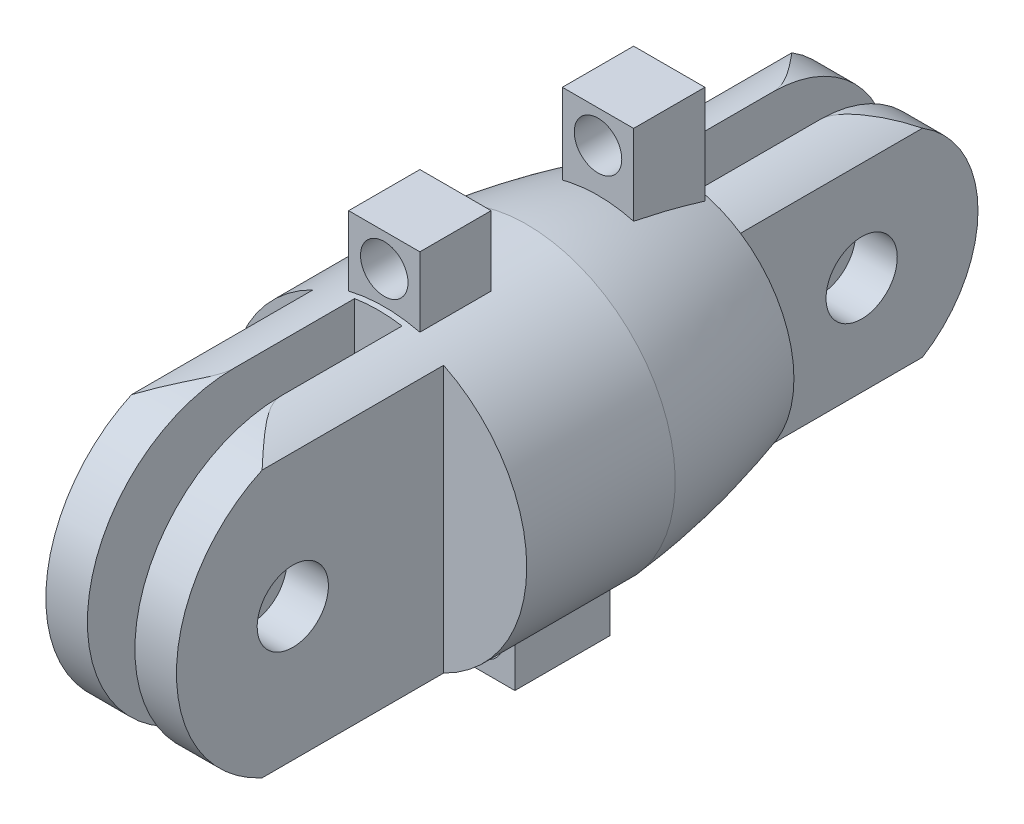
from build123d import *

# Parameters (mm, degrees)
SKETCH1_W                = 11
SKETCH1_H                = 25
BOSS_EXTRUDE1_DEPTH      = 35
CUT_EXTRUDE9_DEPTH       = 31.868357473
CUT_EXTRUDE9_DEPTH_BACK  = 31.868357473
SKETCH6_R                = 20
SKETCH6_R_2              = 12.5
SKETCH7_W                = 11
SKETCH7_H                = 20
BOSS_EXTRUDE3_DEPTH      = 20
SKETCH8_R                = 15
SKETCH8_R_2              = 10
CUT_EXTRUDE10_DEPTH      = 51.682837382
CUT_EXTRUDE11_DEPTH      = 40.210967919
CUT_EXTRUDE11_DEPTH_BACK = 40.210967919
SKETCH9_W                = 4
SKETCH9_H                = 20
SKETCH9_H_2              = 22.5
CUT_EXTRUDE15_START      = -3.5
CUT_EXTRUDE15_DEPTH      = 11
CUT_EXTRUDE16_DEPTH      = 40.893608668
CUT_EXTRUDE16_DEPTH_BACK = 40.893608668
CUT_EXTRUDE17_DEPTH      = 42.29467294
CUT_EXTRUDE17_DEPTH_BACK = 42.29467294
SKETCH14_R               = 3
SKETCH15_W               = 6
SKETCH15_H               = 8
BOSS_EXTRUDE5_DEPTH      = 18
SKETCH17_R               = 2
CUT_EXTRUDE19_DEPTH      = 45.735332948
SKETCH20_W               = 6
SKETCH20_H               = 6
BOSS_EXTRUDE7_DEPTH      = 18
SKETCH21_R               = 2
CUT_EXTRUDE22_DEPTH      = 50.603427453
SCALE1_SCALE             = 0.75


# Read off the part's stored shape, not the designer's step: Cut-Extrude15
with BuildPart() as part:
    # Sketch1 → Boss-Extrude1 (new body)
    with BuildSketch(Plane.XY):
        Rectangle(SKETCH1_W, SKETCH1_H)
    extrude(amount=BOSS_EXTRUDE1_DEPTH)


with BuildPart() as body_2:
    # Sketch2 → Revolve1 (revolve)
    with BuildSketch(Plane(origin=(0, 0, 0), x_dir=(0, 0, -1), z_dir=(1, 0, 0))):
        with BuildLine():
            Line((-12.5, 0), (12.5, 0))
            Line((12.5, 0), (12.5, 10))
            add(Edge.make_bspline(
                [(-12.5, 12.5), (0.245145169, 13.725725845), (12.5, 10)],
                knots=[0, 0, 0, 1, 1, 1], degree=2))
            Line((-12.5, 12.5), (-12.5, 0))
        make_face()
    revolve(axis=Axis((0, 0, 12.5), (0, 0, -1)))


with BuildPart() as cut_extrude9_tool:
    # Sketch6 → Cut-Extrude9 (new, two sides: drawn at the far end of the back side and taken through both)
    with BuildSketch(Plane.XY.offset(12.5).offset(-CUT_EXTRUDE9_DEPTH_BACK)):
        Circle(SKETCH6_R)
        with Locations(Location((0, 0, 0), (0, 0, 270))):
            Circle(SKETCH6_R_2, mode=Mode.SUBTRACT)
    extrude(amount=CUT_EXTRUDE9_DEPTH + CUT_EXTRUDE9_DEPTH_BACK)


with BuildPart() as part_1:
    add(part.part)

    # Cut-Extrude9: cut by cut_extrude9_tool
    add(cut_extrude9_tool.part, mode=Mode.SUBTRACT)


with BuildPart() as body_2_1:
    add(body_2.part)

    # Cut-Extrude9: cut by cut_extrude9_tool
    add(cut_extrude9_tool.part, mode=Mode.SUBTRACT)

    # Sketch7 → Boss-Extrude3 (add)
    with BuildSketch(Plane(origin=(0, 0, -12.5), x_dir=(-1, 0, 0), z_dir=(0, 0, -1))):
        Rectangle(SKETCH7_W, SKETCH7_H)
    extrude(amount=BOSS_EXTRUDE3_DEPTH)

    # Sketch8 → Cut-Extrude10 (cut, through all)
    with BuildSketch(Plane(origin=(0, 0, -12.5), x_dir=(-1, 0, 0), z_dir=(0, 0, -1))):
        Circle(SKETCH8_R)
        Circle(SKETCH8_R_2, mode=Mode.SUBTRACT)
    extrude(amount=CUT_EXTRUDE10_DEPTH, mode=Mode.SUBTRACT)


with BuildPart() as cut_extrude11_tool:
    # Sketch9 → Cut-Extrude11 (new, two sides: drawn at the far end of the back side and taken through both)
    with BuildSketch(Plane(origin=(0, 0, 0), x_dir=(1, 0, 0), z_dir=(0, 1, 0)).offset(-CUT_EXTRUDE11_DEPTH_BACK)):
        with Locations((0, 22.5)):
            Rectangle(SKETCH9_W, SKETCH9_H)
        with Locations((0, -23.75)):
            Rectangle(SKETCH9_W, SKETCH9_H_2)
    extrude(amount=CUT_EXTRUDE11_DEPTH + CUT_EXTRUDE11_DEPTH_BACK)


with BuildPart() as part_2:
    add(part_1.part)

    # Cut-Extrude11: cut by cut_extrude11_tool
    add(cut_extrude11_tool.part, mode=Mode.SUBTRACT)

    # Cut-Extrude15 outline → Cut-Extrude15 (cut)
    with BuildSketch(Plane(origin=(-2, 0, 0), x_dir=(0, 0, -1), z_dir=(1, 0, 0)).offset(CUT_EXTRUDE15_START)):
        with BuildLine():
            Line((-35, 12.338962679), (-35, -1.7e-08))
            ThreePointArc((-35, -1.7e-08), (-31.38600151, 8.724964177), (-22.661037321, 12.338962679))
            Line((-22.661037321, 12.338962679), (-35, 12.338962679))
        make_face()
        with BuildLine():
            Line((-35, -12.338962679), (-22.661037321, -12.338962679))
            ThreePointArc((-22.661037321, -12.338962679), (-31.386001498, -8.724964189), (-35, -1.7e-08))
            Line((-35, -1.7e-08), (-35, -12.338962679))
        make_face()
    extrude(amount=CUT_EXTRUDE15_DEPTH, mode=Mode.SUBTRACT)


with BuildPart() as body_2_2:
    add(body_2_1.part)

    # Cut-Extrude11: cut by cut_extrude11_tool
    add(cut_extrude11_tool.part, mode=Mode.SUBTRACT)

    # Sketch12 → Cut-Extrude16 (cut, two sides: drawn at the far end of the back side and taken through both)
    with BuildSketch(Plane.ZY.offset(-2).offset(-CUT_EXTRUDE16_DEPTH_BACK)):
        with BuildLine():
            ThreePointArc((-32.5, 0), (-29.630244259, 6.92820323), (-22.702041029, 9.797958971))
            Line((-22.702041029, 9.797958971), (-32.5, 9.797958971))
            Line((-32.5, 9.797958971), (-32.5, 0))
        make_face()
        with BuildLine():
            ThreePointArc((-22.702041029, -9.797958971), (-29.630244259, -6.92820323), (-32.5, 0))
            Line((-32.5, 0), (-32.5, -9.797958971))
            Line((-32.5, -9.797958971), (-22.702041029, -9.797958971))
        make_face()
    extrude(amount=CUT_EXTRUDE16_DEPTH + CUT_EXTRUDE16_DEPTH_BACK, mode=Mode.SUBTRACT)


with BuildPart() as cut_extrude17_tool:
    # Sketch14 → Cut-Extrude17 (new, two sides: drawn at the far end of the back side and taken through both)
    with BuildSketch(Plane.ZY.offset(5.5).offset(-CUT_EXTRUDE17_DEPTH_BACK)):
        with Locations(Location((-22.702041029, 0, 0), (0, 0, 270))):
            Circle(SKETCH14_R)
        with Locations(Location((25.202041029, 0, 0), (0, 0, 270))):
            Circle(SKETCH14_R)
    extrude(amount=CUT_EXTRUDE17_DEPTH + CUT_EXTRUDE17_DEPTH_BACK)


with BuildPart() as part_3:
    add(part_2.part)

    # Cut-Extrude17: cut by cut_extrude17_tool
    add(cut_extrude17_tool.part, mode=Mode.SUBTRACT)



with BuildPart() as body_2_3:
    add(body_2_2.part)

    # Cut-Extrude17: cut by cut_extrude17_tool
    add(cut_extrude17_tool.part, mode=Mode.SUBTRACT)


with BuildPart() as part_4:
    add(part_3.part)

    add(body_2_3.part)  # Boss-Extrude5 merges body 2
    # Sketch15 → Boss-Extrude5 (add)
    with BuildSketch(Plane(origin=(0, 0, 0), x_dir=(1, 0, 0), z_dir=(0, 1, 0))):
        Rectangle(SKETCH15_W, SKETCH15_H)
    extrude(amount=-BOSS_EXTRUDE5_DEPTH)

    # Sketch17 → Cut-Extrude19 (cut, through all)
    with BuildSketch(Plane(origin=(0, 0, -4), x_dir=(-1, 0, 0), z_dir=(0, 0, -1))):
        with Locations((0, -14.989547851)):
            Circle(SKETCH17_R)
    extrude(amount=-CUT_EXTRUDE19_DEPTH, mode=Mode.SUBTRACT)

    # Sketch20 → Boss-Extrude7 (add)
    with BuildSketch(Plane(origin=(0, 0, 0), x_dir=(1, 0, 0), z_dir=(0, 1, 0))):
        with Locations((0, 9)):
            Rectangle(SKETCH20_W, SKETCH20_H)
        with Locations((0, -9)):
            Rectangle(SKETCH20_W, SKETCH20_H)
    extrude(amount=BOSS_EXTRUDE7_DEPTH)

    # Sketch21 → Cut-Extrude22 (cut, through all)
    with BuildSketch(Plane.XY.offset(12)):
        with Locations((0, 15.25)):
            Circle(SKETCH21_R)
    extrude(amount=-CUT_EXTRUDE22_DEPTH, mode=Mode.SUBTRACT)


with BuildPart() as part_5:
    # Scale1: scaled about (2.31e-07, 0.10771387, 1.886694497)
    add(part_4.part.scale(SCALE1_SCALE).moved(Location((5.8e-08, 0.026928468, 0.471673624))))


solid = part_5.part
